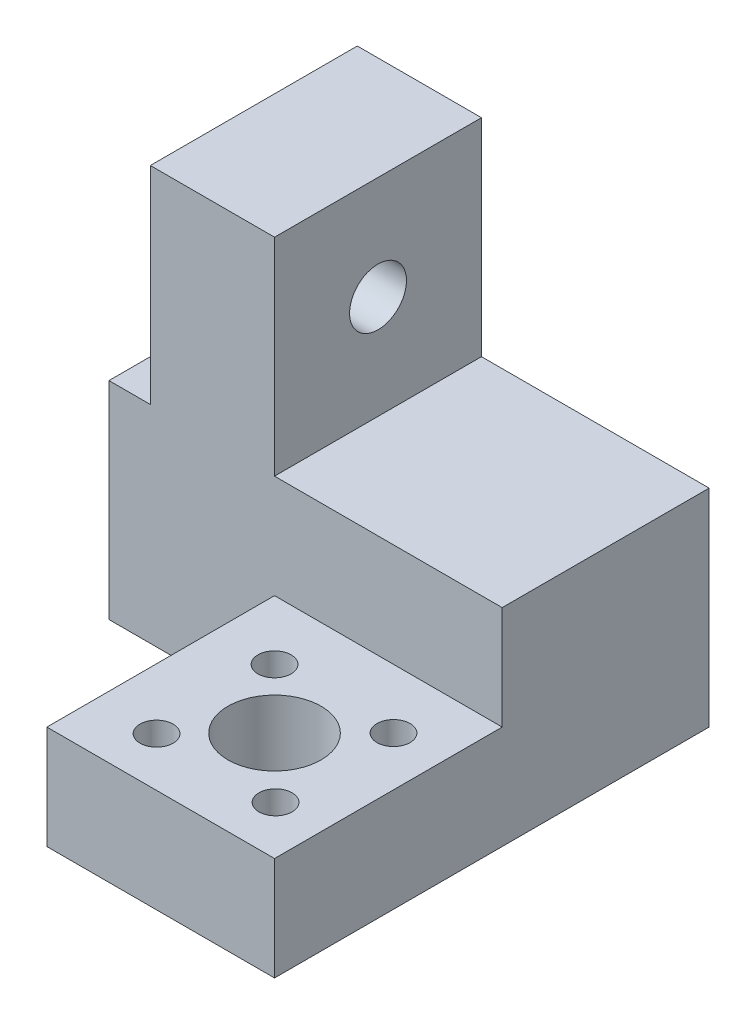
from build123d import *

# Parameters (mm, degrees)
SKETCH1_W           = 22
SKETCH1_H           = 22
SKETCH1_R           = 1.6
BOSS_EXTRUDE1_DEPTH = 10
SKETCH2_W           = 38
SKETCH2_H           = 20
BOSS_EXTRUDE2_DEPTH = 20
SKETCH3_W           = 12
SKETCH3_H           = 20
BOSS_EXTRUDE3_DEPTH = 20
SKETCH4_R           = 2.75
CUT_EXTRUDE1_DEPTH  = 56.181518645
SKETCH5_R           = 4.5
CUT_EXTRUDE2_DEPTH  = 51.8920426


with BuildPart() as part:
    # Sketch1 → Boss-Extrude1 (new body)
    with BuildSketch(Plane(origin=(0, 0, 0), x_dir=(1, 0, 0), z_dir=(0, 1, 0))):
        Rectangle(SKETCH1_W, SKETCH1_H)
        with Locations((-5.25, 5.25)):
            Circle(SKETCH1_R, mode=Mode.SUBTRACT)
        with Locations((6.25, 5.25)):
            Circle(SKETCH1_R, mode=Mode.SUBTRACT)
        with Locations((6.348618383, -6.25)):
            Circle(SKETCH1_R, mode=Mode.SUBTRACT)
        with Locations((-5.151381617, -6.25)):
            Circle(SKETCH1_R, mode=Mode.SUBTRACT)
    extrude(amount=BOSS_EXTRUDE1_DEPTH)

    # Sketch2 → Boss-Extrude2 (add)
    with BuildSketch(Plane(origin=(0, 0, -11), x_dir=(-1, 0, 0), z_dir=(0, 0, -1))):
        with Locations((8, 10)):
            Rectangle(SKETCH2_W, SKETCH2_H)
    extrude(amount=BOSS_EXTRUDE2_DEPTH)

    # Sketch3 → Boss-Extrude3 (add)
    with BuildSketch(Plane(origin=(0, 20, 0), x_dir=(1, 0, 0), z_dir=(0, 1, 0))):
        with Locations((-17, 21)):
            Rectangle(SKETCH3_W, SKETCH3_H)
    extrude(amount=BOSS_EXTRUDE3_DEPTH)

    # Sketch4 → Cut-Extrude1 (cut, through all)
    with BuildSketch(Plane(origin=(-11, 0, 0), x_dir=(0, 0, -1), z_dir=(1, 0, 0))):
        with Locations((21, 30)):
            Circle(SKETCH4_R)
    extrude(amount=-CUT_EXTRUDE1_DEPTH, mode=Mode.SUBTRACT)

    # Sketch5 → Cut-Extrude2 (cut, through all)
    with BuildSketch(Plane(origin=(0, 10, 0), x_dir=(1, 0, 0), z_dir=(0, 1, 0))):
        with Locations((0.5, -0.5)):
            Circle(SKETCH5_R)
    extrude(amount=-CUT_EXTRUDE2_DEPTH, mode=Mode.SUBTRACT)


solid = part.part
